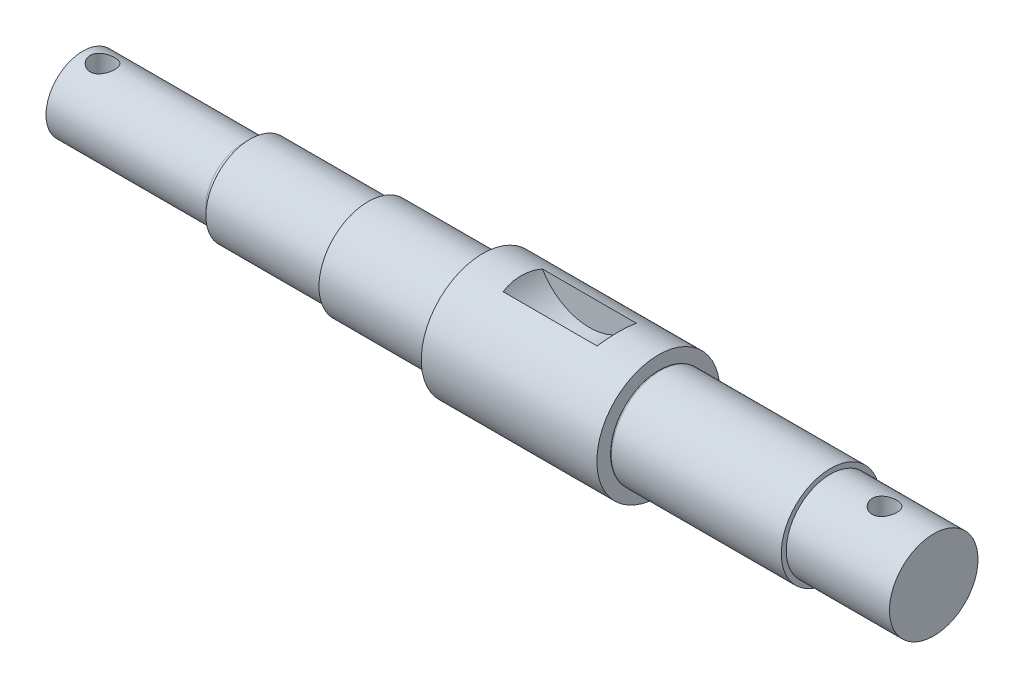
from build123d import *

# Parameters (mm, degrees)
SKETCH_2_R               = 9
EXTRUDE_1_DEPTH          = 21
SKETCH_2_3_R             = 10
EXTRUDE_2_DEPTH          = 35
EXTRUDE_START            = -35
SKETCH_2_4_R             = 12.5
EXTRUDE_3_DEPTH          = 35.7
SKETCH_3_R               = 10
EXTRUDE_4_DEPTH          = 23.3
EXTRUDE_START_2          = 47.3
SKETCH_3_3_R             = 9
EXTRUDE_5_DEPTH          = 34
EXTRUDE_6_DEPTH          = 34
EXTRUDE_6_DEPTH_BACK     = 16
EXTRUDE_6_START          = 47.3
SKETCH_3_4_R             = 7.5
FILLET_1_R               = 1.5
FILLET_2_R               = 0.5
FILLET_3_R               = 0.5
SKETCH_4_R               = 2.5
CUT_EXTRUDE_1_DEPTH      = 34
CUT_EXTRUDE_2_DEPTH      = 4
CUT_EXTRUDE_2_DEPTH_BACK = 4
SKETCH_5_R               = 11


with BuildPart() as part:
    # 스케치2 → 보스-돌출1 (new body)
    with BuildSketch(Plane(origin=(0, 0, 0), x_dir=(0, 0, -1), z_dir=(1, 0, 0))):
        with Locations(Location((0, 0, 0), (0, 0, 180))):
            Circle(SKETCH_2_R)
    extrude(amount=EXTRUDE_1_DEPTH)

    # 스케치2<3> → 보스-돌출2 (add)
    with BuildSketch(Plane(origin=(0, 0, 0), x_dir=(0, 0, -1), z_dir=(1, 0, 0))):
        Circle(SKETCH_2_3_R)
    extrude(amount=-EXTRUDE_2_DEPTH)

    # 필렛3
    fillet_3_edges = [part.edges().sort_by_distance(p)[0] for p in [
        (-35, 0, 10),
    ]]
    fillet(fillet_3_edges, radius=FILLET_3_R)


with BuildPart() as body_2:
    # 스케치2<4> → 보스-돌출3 (new body)
    with BuildSketch(Plane(origin=(0, 0, 0), x_dir=(0, 0, -1), z_dir=(1, 0, 0)).offset(EXTRUDE_START)):
        Circle(SKETCH_2_4_R)
    extrude(amount=-EXTRUDE_3_DEPTH)

    # 스케치3 → 보스-돌출4 (add)
    with BuildSketch(Plane.ZY.offset(70.7)):
        Circle(SKETCH_3_R)
    extrude(amount=EXTRUDE_4_DEPTH)

    # 스케치3<3> → 보스-돌출5 (add)
    with BuildSketch(Plane.ZY.offset(70.7).offset(EXTRUDE_START_2)):
        Circle(SKETCH_3_3_R)
    extrude(amount=-EXTRUDE_5_DEPTH)

    # 스케치3<4> → 보스-돌출6 (add, two sides: drawn at the far end of the back side and taken through both)
    with BuildSketch(Plane.ZY.offset(70.7).offset(EXTRUDE_6_START - EXTRUDE_6_DEPTH_BACK)):
        Circle(SKETCH_3_4_R)
    extrude(amount=EXTRUDE_6_DEPTH + EXTRUDE_6_DEPTH_BACK)

    # 필렛1
    fillet_1_edges = [body_2.edges().sort_by_distance(p)[0] for p in [
        (-118, 0, -7.5),
    ]]
    fillet(fillet_1_edges, radius=FILLET_1_R - 0.0001)  # a hair under: the kernel refuses the full size

    # 필렛2
    fillet_2_edges = [body_2.edges().sort_by_distance(p)[0] for p in [
        (-70.7, 0, -10),
    ]]
    fillet(fillet_2_edges, radius=FILLET_2_R)


with BuildPart() as cut_extrude_1_tool:
    # 스케치4 → 컷-돌출1 (new body)
    with BuildSketch(Plane(origin=(0, 14, 0), x_dir=(1, 0, 0), z_dir=(0, 1, 0))):
        with Locations(Location((-148, 0, 0), (0, 0, 270))):
            Circle(SKETCH_4_R)
        with Locations(Location((11, 0, 0), (0, 0, 270))):
            Circle(SKETCH_4_R)
    extrude(amount=-CUT_EXTRUDE_1_DEPTH)


with BuildPart() as part_1:
    add(part.part)

    # 컷-돌출1: cut by cut_extrude_1_tool
    add(cut_extrude_1_tool.part, mode=Mode.SUBTRACT)


with BuildPart() as body_2_1:
    add(body_2.part)

    # 컷-돌출1: cut by cut_extrude_1_tool
    add(cut_extrude_1_tool.part, mode=Mode.SUBTRACT)

    # 스케치5 → 컷-돌출2 (cut, two sides: drawn at the far end of the back side and taken through both)
    with BuildSketch(Plane.XY.offset(-CUT_EXTRUDE_2_DEPTH_BACK)):
        with Locations((-53, 17.3)):
            Circle(SKETCH_5_R)
    extrude(amount=CUT_EXTRUDE_2_DEPTH + CUT_EXTRUDE_2_DEPTH_BACK, mode=Mode.SUBTRACT)


solid = Compound([part_1.part, body_2_1.part])
